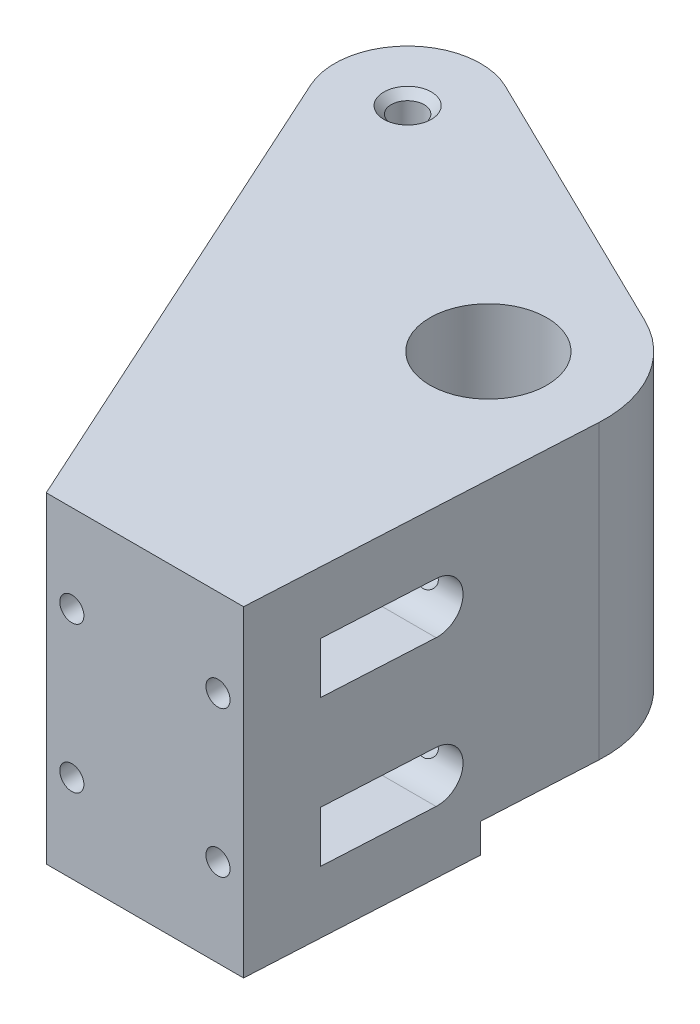
from build123d import *

# Parameters (mm, degrees)
SKETCH1_R                      = 8
SKETCH1_R_2                    = 2.25
BOSS_EXTRUDE1_DEPTH            = 44
CUT_EXTRUDE4_DEPTH             = 4
CUT_EXTRUDE5_DEPTH             = 103.107700493
F_4_5_4_5_DIAMETER_HOLE1_D     = 4.5
F_4_5_4_5_DIAMETER_HOLE1_DEPTH = 10
F_4_5_4_5_DIAMETER_HOLE1_TIP   = 1.351936393
CHAMFER1_SIZE                  = 1
F_3_3_3_3_DIAMETER_HOLE1_D     = 3.3
CUT_EXTRUDE6_DEPTH             = 103.107700536
CUT_EXTRUDE6_DEPTH_BACK        = 103.107700536


with BuildPart() as part:
    # Sketch1 → Boss-Extrude1 (new body)
    with BuildSketch(Plane(origin=(0, 0, 0), x_dir=(1, 0, 0), z_dir=(0, 1, 0))):
        with BuildLine():
            Line((-13.5, 0), (13.5, 0))
            Line((13.5, 0), (15.976995957, 46.142328626))
            ThreePointArc((15.976995957, 46.142328626), (13.793369664, 55.108202842), (7.021555451, 61.376987134))
            Line((7.021555451, 61.376987134), (-30.261527843, 79.585616959))
            ThreePointArc((-30.261527843, 79.585616959), (-41.624453455, 77.76637977), (-43.75141009, 66.457013833))
            Line((-43.75141009, 66.457013833), (-13.5, 0))
        make_face()
        with Locations((0, 47)):
            Circle(SKETCH1_R, mode=Mode.SUBTRACT)
        with Locations((-34.65, 70.6)):
            Circle(SKETCH1_R_2, mode=Mode.SUBTRACT)
    extrude(amount=BOSS_EXTRUDE1_DEPTH)

    # Sketch2 → Cut-Extrude4 (cut)
    with BuildSketch(Plane.XZ):
        Polygon((0, -30.75), (15.150710485, -30.75), (16.545133066, -56.725781169), (-44.65, -86.612781563), (-44.65, -30.75), align=None)
    extrude(amount=-CUT_EXTRUDE4_DEPTH, mode=Mode.SUBTRACT)

    # Sketch4 → Cut-Extrude5 (cut, through all)
    with BuildSketch(Plane.XY):
        Polygon((-16, 0), (-44.65, 37), (-44.65, 0), align=None)
    extrude(amount=-CUT_EXTRUDE5_DEPTH, mode=Mode.SUBTRACT)

    # Ø4.5 (4.5) Diameter Hole1
    with Locations(Plane(origin=(0, 4, 0), x_dir=(-1, 0, 0), z_dir=(0, -1, 0))):
        with Locations((0, 35), (0, 59), (12, 47), (-12, 47)):
            Hole(F_4_5_4_5_DIAMETER_HOLE1_D / 2, depth=F_4_5_4_5_DIAMETER_HOLE1_DEPTH)
            with Locations((0, 0, -(F_4_5_4_5_DIAMETER_HOLE1_DEPTH + F_4_5_4_5_DIAMETER_HOLE1_TIP / 2))):  # 118° drill point
                Cone(0, F_4_5_4_5_DIAMETER_HOLE1_D / 2, F_4_5_4_5_DIAMETER_HOLE1_TIP, mode=Mode.SUBTRACT)

    # Chamfer1
    chamfer1_edges = [part.edges().sort_by_distance(p)[0] for p in [
        (-36.9, 44, -70.6),
        (-2.25, 4, -35),
        (-14.25, 4, -47),
        (-2.25, 4, -59),
        (9.75, 4, -47),
    ]]
    chamfer(chamfer1_edges, length=CHAMFER1_SIZE)

    # Ø3.3 (3.3) Diameter Hole1 (through all)
    with Locations(Plane.XY):
        with Locations((-10, 32), (10, 32), (10, 12), (-10, 12)):
            Hole(F_3_3_3_3_DIAMETER_HOLE1_D / 2)

    # Sketch13 → Cut-Extrude6 (cut, two sides: drawn at the far end of the back side and taken through both)
    with BuildSketch(Plane(origin=(0, 0, 0), x_dir=(0, 0, -1), z_dir=(1, 0, 0)).offset(-CUT_EXTRUDE6_DEPTH_BACK)):
        with BuildLine():
            Line((10, 35.5), (25, 35.5))
            ThreePointArc((25, 35.5), (28.5, 32), (25, 28.5))
            Line((25, 28.5), (10, 28.5))
            Line((10, 28.5), (10, 35.5))
        make_face()
        with BuildLine():
            Line((10, 15.5), (25, 15.5))
            ThreePointArc((25, 15.5), (28.5, 12), (25, 8.5))
            Line((25, 8.5), (10, 8.5))
            Line((10, 8.5), (10, 15.5))
        make_face()
    extrude(amount=CUT_EXTRUDE6_DEPTH + CUT_EXTRUDE6_DEPTH_BACK, mode=Mode.SUBTRACT)


solid = part.part
